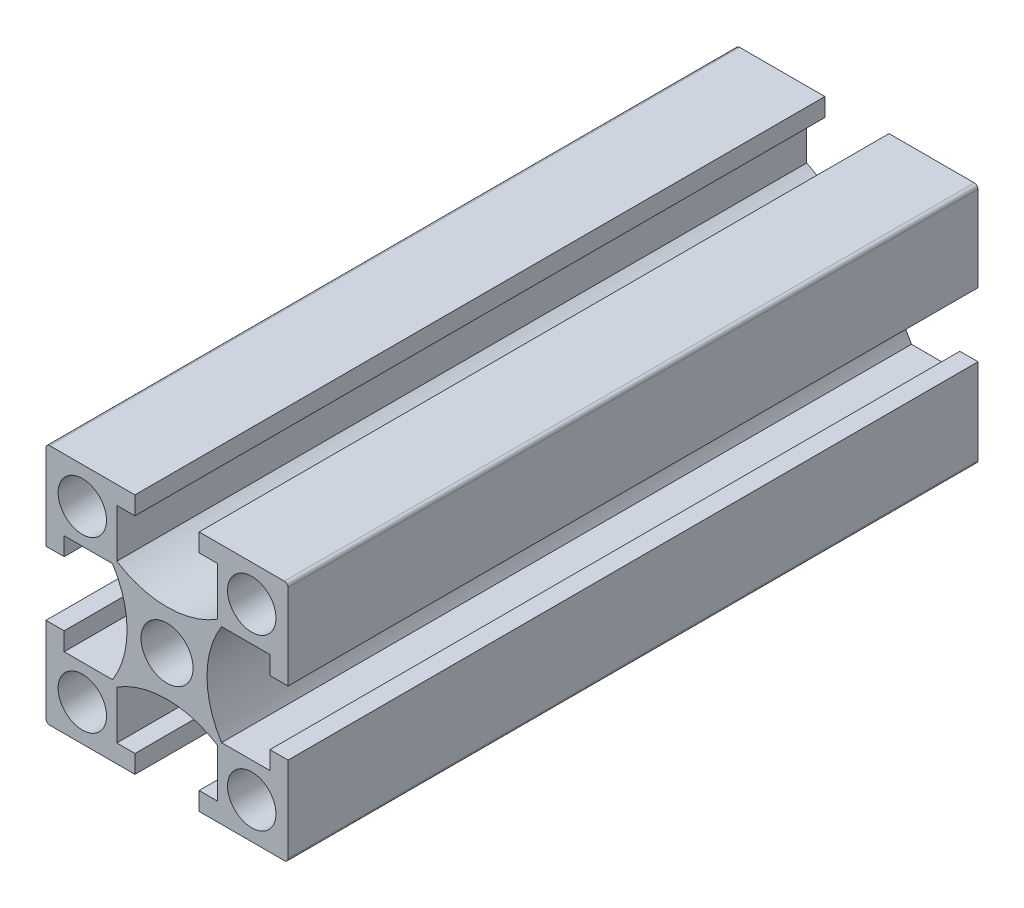
from build123d import *

# Parameters (mm, degrees)
SKETCH_1_W               = 20
SKETCH_1_H               = 20
SKETCH_1_R               = 2
SKETCH_1_R_2             = 2.15
EXTRUDE_1_DEPTH          = 57
CUT_EXTRUDE_1_REACH      = 60.728
PATTERN_CIRCULAR_1_COUNT = 4
FILLET_1_R               = 0.3
CUT_EXTRUDE_2_DEPTH      = 59.72818744
CUT_EXTRUDE_2_DEPTH_BACK = 59.72818744
SKETCH_2_R               = 2.5


with BuildPart() as part:
    # 스케치1 → 보스-돌출1 (new body)
    with BuildSketch(Plane.XY):
        Rectangle(SKETCH_1_W, SKETCH_1_H)
        with Locations((-7, -7)):
            Circle(SKETCH_1_R, mode=Mode.SUBTRACT)
        with Locations((7, -7)):
            Circle(SKETCH_1_R, mode=Mode.SUBTRACT)
        with Locations((-7, 7)):
            Circle(SKETCH_1_R, mode=Mode.SUBTRACT)
        Circle(SKETCH_1_R_2, mode=Mode.SUBTRACT)
        with Locations((7, 7)):
            Circle(SKETCH_1_R, mode=Mode.SUBTRACT)
    extrude(amount=EXTRUDE_1_DEPTH)

    # 스케치1<3> → 컷-돌출1 (cut, up to next)
    with BuildSketch(Plane.XY, mode=Mode.PRIVATE) as cut_extrude_1_sk1:
        with BuildLine():
            Line((-8.5, 2.65), (-10, 2.65))
            Line((-10, 2.65), (-10, -2.65))
            Line((-10, -2.65), (-8.5, -2.65))
            Line((-8.5, -2.65), (-8.5, -4.15))
            Line((-8.5, -4.15), (-4.503166667, -4.15))
            ThreePointArc((-4.503166667, -4.15), (-3.3, 0), (-4.503166667, 4.15))
            Line((-4.503166667, 4.15), (-8.5, 4.15))
            Line((-8.5, 4.15), (-8.5, 2.65))
        make_face()
    cut_extrude_1_tool1 = extrude(cut_extrude_1_sk1.sketch, amount=CUT_EXTRUDE_1_REACH, mode=Mode.PRIVATE) & part.part
    cut_extrude_1 = cut_extrude_1_tool1.solids().sort_by_distance((-6.606913, 0, 0))[0]
    add(cut_extrude_1, mode=Mode.SUBTRACT)

    # 원형 패턴1: 컷-돌출1 ×4 about axis
    pattern_circular_1_axis = Axis((0, 0, 57), (0, 0, -1))
    for i in range(1, PATTERN_CIRCULAR_1_COUNT):
        add(cut_extrude_1.rotate(pattern_circular_1_axis, i * 360 / PATTERN_CIRCULAR_1_COUNT), mode=Mode.SUBTRACT)

    # 필렛1
    fillet_1_edges = [part.edges().sort_by_distance(p)[0] for p in [
        (10, -10, 28.5),
        (-10, -10, 28.5),
        (-10, 10, 28.5),
        (10, 10, 28.5),
    ]]
    fillet(fillet_1_edges, radius=FILLET_1_R)

    # 스케치2 → 컷-돌출2 (cut, two sides: drawn at the far end of the back side and taken through both)
    with BuildSketch(Plane(origin=(0, 0, 0), x_dir=(0, 0, -1), z_dir=(1, 0, 0)).offset(-CUT_EXTRUDE_2_DEPTH_BACK)):
        with Locations((-19, 0)):
            Circle(SKETCH_2_R)
    extrude(amount=CUT_EXTRUDE_2_DEPTH + CUT_EXTRUDE_2_DEPTH_BACK, mode=Mode.SUBTRACT)


solid = part.part
